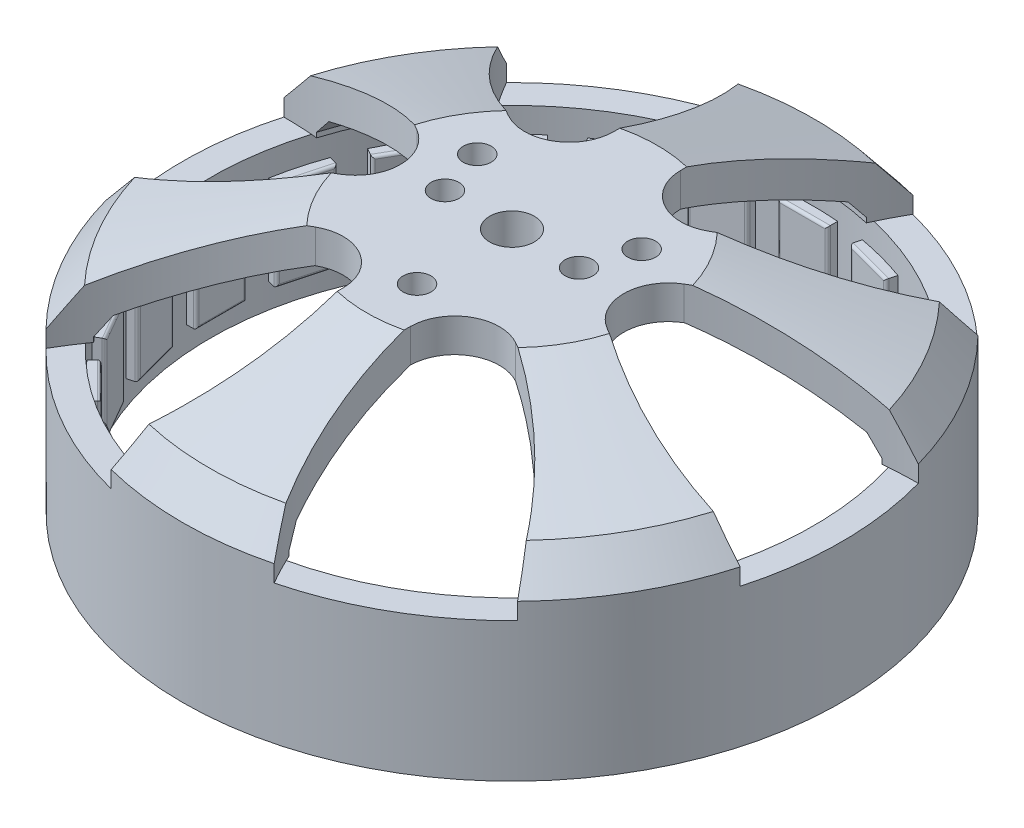
from build123d import *
from build123d.topology import SkipClean

# Parameters (mm, degrees)
SKETCH1_R                = 29.5
SKETCH1_R_2              = 27
BOSS_EXTRUDE1_DEPTH      = 12.45
SKETCH3_W                = 4.5
SKETCH3_H                = 8
BOSS_EXTRUDE2_DEPTH      = 1
FILLET1_R                = 0.25
CIRPATTERN1_COUNT        = 24
FILLET1_OF_CIRPATTERN1_R = 0.25
CUT_EXTRUDE1_DEPTH       = 9.5
CIRPATTERN2_COUNT        = 6
M3X0_5_TAPPED_HOLE1_D    = 2.5
SKETCH7_R                = 2
CUT_EXTRUDE2_DEPTH       = 3


with BuildPart() as part:
    # Sketch1 → Boss-Extrude1 (new body)
    with BuildSketch(Plane(origin=(0, 0, 0), x_dir=(1, 0, 0), z_dir=(0, 1, 0))):
        Circle(SKETCH1_R)
        Circle(SKETCH1_R_2, mode=Mode.SUBTRACT)
    extrude(amount=BOSS_EXTRUDE1_DEPTH)

    # Sketch3 → Boss-Extrude2 (add, symmetric)
    with BuildSketch(Plane(origin=(-27, 0, 0), x_dir=(0, 0, -1), z_dir=(1, 0, 0))):
        with Locations((0, 6.225)):
            Rectangle(SKETCH3_W, SKETCH3_H)
    boss_extrude2 = extrude(amount=BOSS_EXTRUDE2_DEPTH, both=True)

    # Fillet1
    fillet1_edges = [part.edges().sort_by_distance(p)[0] for p in [
        (-26, 6.225, 2.25),
        (-26, 6.225, -2.25),
        (-26, 2.225, 0),
        (-26, 10.225, 0),
    ]]
    fillet(fillet1_edges, radius=FILLET1_R)

    # CirPattern1: Boss-Extrude2 ×24 about axis
    cirpattern1_axis = Axis((0, 12.45, 0), (0, 1, 0))
    for i in range(1, CIRPATTERN1_COUNT):
        add(boss_extrude2.rotate(cirpattern1_axis, i * 360 / CIRPATTERN1_COUNT))

    # Fillet1 of CirPattern1
    fillet1_of_cirpattern1_edges = [part.edges().sort_by_distance(p)[0] for p in [
        (-24.531728632, 6.225, 8.902628282),
        (-25.696414335, 6.225, 4.555962064),
        (-25.114071484, 2.225, 6.729295173),
        (-25.114071484, 10.225, 6.729295173),
        (-21.391660498, 6.225, 14.948557159),
        (-23.641660498, 6.225, 11.051442841),
        (-22.516660498, 2.225, 13),
        (-22.516660498, 10.225, 13),
        (-16.793786053, 6.225, 19.975766569),
        (-19.975766569, 6.225, 16.793786053),
        (-18.384776311, 2.225, 18.384776311),
        (-18.384776311, 10.225, 18.384776311),
        (-11.051442841, 6.225, 23.641660498),
        (-14.948557159, 6.225, 21.391660498),
        (-13, 2.225, 22.516660498),
        (-13, 10.225, 22.516660498),
        (-4.555962064, 6.225, 25.696414335),
        (-8.902628282, 6.225, 24.531728632),
        (-6.729295173, 2.225, 25.114071484),
        (-6.729295173, 10.225, 25.114071484),
        (2.25, 6.225, 26),
        (-2.25, 6.225, 26),
        (0, 2.225, 26),
        (0, 10.225, 26),
        (8.902628282, 6.225, 24.531728632),
        (4.555962064, 6.225, 25.696414335),
        (6.729295173, 2.225, 25.114071484),
        (6.729295173, 10.225, 25.114071484),
        (14.948557159, 6.225, 21.391660498),
        (11.051442841, 6.225, 23.641660498),
        (13, 2.225, 22.516660498),
        (13, 10.225, 22.516660498),
        (19.975766569, 6.225, 16.793786053),
        (16.793786053, 6.225, 19.975766569),
        (18.384776311, 2.225, 18.384776311),
        (18.384776311, 10.225, 18.384776311),
        (23.641660498, 6.225, 11.051442841),
        (21.391660498, 6.225, 14.948557159),
        (22.516660498, 2.225, 13),
        (22.516660498, 10.225, 13),
        (25.696414335, 6.225, 4.555962064),
        (24.531728632, 6.225, 8.902628282),
        (25.114071484, 2.225, 6.729295173),
        (25.114071484, 10.225, 6.729295173),
        (26, 6.225, -2.25),
        (26, 6.225, 2.25),
        (26, 2.225, 0),
        (26, 10.225, 0),
        (24.531728632, 6.225, -8.902628282),
        (25.696414335, 6.225, -4.555962064),
        (25.114071484, 2.225, -6.729295173),
        (25.114071484, 10.225, -6.729295173),
        (21.391660498, 6.225, -14.948557159),
        (23.641660498, 6.225, -11.051442841),
        (22.516660498, 2.225, -13),
        (22.516660498, 10.225, -13),
        (16.793786053, 6.225, -19.975766569),
        (19.975766569, 6.225, -16.793786053),
        (18.384776311, 2.225, -18.384776311),
        (18.384776311, 10.225, -18.384776311),
        (11.051442841, 6.225, -23.641660498),
        (14.948557159, 6.225, -21.391660498),
        (13, 2.225, -22.516660498),
        (13, 10.225, -22.516660498),
        (4.555962064, 6.225, -25.696414335),
        (8.902628282, 6.225, -24.531728632),
        (6.729295173, 2.225, -25.114071484),
        (6.729295173, 10.225, -25.114071484),
        (-2.25, 6.225, -26),
        (2.25, 6.225, -26),
        (0, 2.225, -26),
        (0, 10.225, -26),
        (-8.902628282, 6.225, -24.531728632),
        (-4.555962064, 6.225, -25.696414335),
        (-6.729295173, 2.225, -25.114071484),
        (-6.729295173, 10.225, -25.114071484),
        (-14.948557159, 6.225, -21.391660498),
        (-11.051442841, 6.225, -23.641660498),
        (-13, 2.225, -22.516660498),
        (-13, 10.225, -22.516660498),
        (-19.975766569, 6.225, -16.793786053),
        (-16.793786053, 6.225, -19.975766569),
        (-18.384776311, 2.225, -18.384776311),
        (-18.384776311, 10.225, -18.384776311),
        (-23.641660498, 6.225, -11.051442841),
        (-21.391660498, 6.225, -14.948557159),
        (-22.516660498, 2.225, -13),
        (-22.516660498, 10.225, -13),
        (-25.696414335, 6.225, -4.555962064),
        (-24.531728632, 6.225, -8.902628282),
        (-25.114071484, 2.225, -6.729295173),
        (-25.114071484, 10.225, -6.729295173),
    ]]
    fillet(fillet1_of_cirpattern1_edges, radius=FILLET1_OF_CIRPATTERN1_R)

    # Sketch4 → Revolve1 (revolve)
    with BuildSketch(Plane(origin=(0, 0, 0), x_dir=(0, 0, -1), z_dir=(1, 0, 0))):
        Polygon((-27.075, 16.95), (-13, 21.95), (0, 21.95), (0, 18.95), (-12.482967585, 18.95), (-25.2736698, 14.406233672), (-26.5, 12.889124146), (-26.5, 12.45), (-29.5, 12.45), (-29.5, 13.95), align=None)
    revolve(axis=Axis((0, 0, 0), (0, 1, 0)))

    # Sketch5 → Cut-Extrude1 (cut)
    with SkipClean():  # the faces are left unmerged after this step: merging them gives an invalid solid
        with BuildSketch(Plane(origin=(0, 21.95, 0), x_dir=(1, 0, 0), z_dir=(0, 1, 0))):
            with BuildLine():
                Line((-28.40157346, -7.975), (-30.40157346, -7.975))
                Line((-30.40157346, -7.975), (-30.40157346, 7.975))
                Line((-30.40157346, 7.975), (-28.40157346, 7.975))
                ThreePointArc((-28.40157346, 7.975), (-19.867282809, 6.818834509), (-11.948217554, 3.433684434))
                ThreePointArc((-11.948217554, 3.433684434), (-10, 0), (-11.948217554, -3.433684434))
                ThreePointArc((-11.948217554, -3.433684434), (-19.867282809, -6.818834509), (-28.40157346, -7.975))
            make_face()
        cut_extrude1 = extrude(amount=-CUT_EXTRUDE1_DEPTH, mode=Mode.SUBTRACT)

    # CirPattern2: Cut-Extrude1 ×6 about axis
    with SkipClean():  # the faces are left unmerged after this step: merging them gives an invalid solid
        cirpattern2_axis = Axis((0, 12.45, 0), (0, -1, 0))
        for i in range(1, CIRPATTERN2_COUNT):
            add(cut_extrude1.rotate(cirpattern2_axis, i * 360 / CIRPATTERN2_COUNT), mode=Mode.SUBTRACT)

    # M3x0.5 Tapped Hole1 (through all)
    with Locations(Plane(origin=(-7.361215932, 21.95, -4.25), x_dir=(0, 0, 1), z_dir=(0, 1, 0))):
        with Locations((0, 0), (4.25, 1.361215932), (4.25, 13.361215932), (0, 14.722431864), (12.75, 7.361215932)):
            Hole(M3X0_5_TAPPED_HOLE1_D / 2)

    # Sketch7 → Cut-Extrude2 (cut)
    with SkipClean():  # the faces are left unmerged after this step: merging them gives an invalid solid
        with BuildSketch(Plane(origin=(0, 21.95, 0), x_dir=(1, 0, 0), z_dir=(0, 1, 0))):
            Circle(SKETCH7_R)
        extrude(amount=-CUT_EXTRUDE2_DEPTH, mode=Mode.SUBTRACT)


solid = part.part
